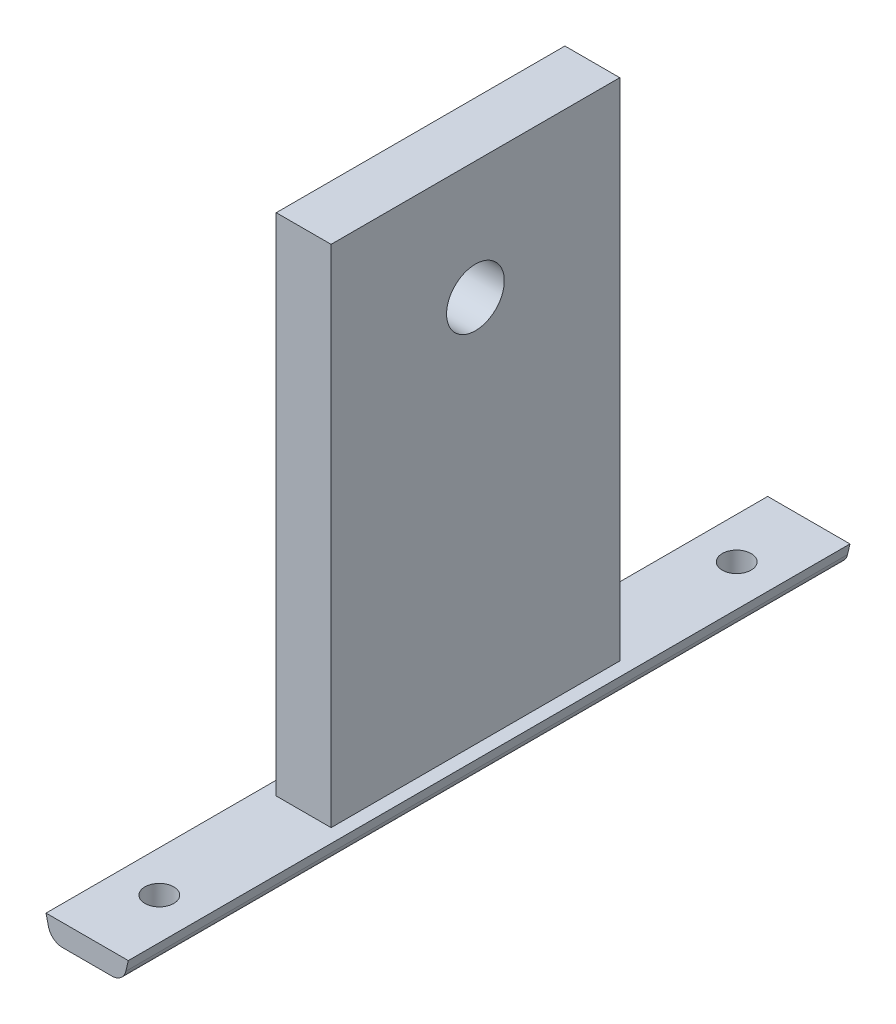
from build123d import *

# Parameters (mm, degrees)
RESSALTO_EXTRUS_O2_DEPTH   = 100
CORTE_EXTRUS_O4_DEPTH      = 30
CORTE_EXTRUS_O4_DEPTH_BACK = 1
ESBO_O2_W                  = 7.6
ESBO_O2_H                  = 70
CORTE_EXTRUS_O5_DEPTH      = 30
CORTE_EXTRUS_O7_DEPTH      = 21
CORTE_EXTRUS_O7_DEPTH_BACK = 22
F_3DSKETCH4_R              = 2
CORTE_EXTRUS_O8_START      = -3.8
CORTE_EXTRUS_O8_OUTLINE_R  = 4
CORTE_EXTRUS_O8_DEPTH      = 7.6


# Read off the part's stored shape, not the designer's step: Corte-extrusão8
with BuildPart() as part:
    # Esboço1 → Ressalto-extrusão2 (new body)
    with BuildSketch(Plane.XY):
        with BuildLine():
            Line((-3.8, -48.178624659), (-5.7, -48.178624659))
            Line((-5.7, -48.178624659), (-5.360626179, -49.63308389))
            ThreePointArc((-5.360626179, -49.63308389), (-4.656141559, -50.745296045), (-3.41294376, -51.178624659))
            Line((-3.41294376, -51.178624659), (3.41294376, -51.178624659))
            ThreePointArc((3.41294376, -51.178624659), (4.656141559, -50.745296045), (5.360626179, -49.63308389))
            Line((5.360626179, -49.63308389), (5.7, -48.178624659))
            Line((5.7, -48.178624659), (3.8, -48.178624659))
            Line((3.8, -48.178624659), (3.8, 21.821375341))
            Line((3.8, 21.821375341), (-3.8, 21.821375341))
            Line((-3.8, 21.821375341), (-3.8, -48.178624659))
        make_face()
    extrude(amount=RESSALTO_EXTRUS_O2_DEPTH)

    # Esboço2 → Corte-extrusão4 (cut, two sides: drawn at the far end of the back side and taken through both)
    with BuildSketch(Plane.XY.offset(-CORTE_EXTRUS_O4_DEPTH_BACK)):
        with Locations((0, -13.178624659)):
            Rectangle(ESBO_O2_W, ESBO_O2_H)
    extrude(amount=CORTE_EXTRUS_O4_DEPTH + CORTE_EXTRUS_O4_DEPTH_BACK, mode=Mode.SUBTRACT)

    # 3DSketch1 → Corte-extrusão5 (cut)
    with BuildSketch(Plane(origin=(-3.8, 21.821375341, 100), x_dir=(0.10793712415834626, -0.9941577225110841, 0), z_dir=(0, 0, 1))):
        Polygon((0, 0), (0.820322144, 7.555598691), (70.411362719, 0), (69.591040576, -7.555598691), align=None)
    extrude(amount=-CORTE_EXTRUS_O5_DEPTH, mode=Mode.SUBTRACT)

    # 3DSketch4 → Corte-extrusão7 (cut, two sides: drawn at the far end of the back side and taken through both)
    with BuildSketch(Plane(origin=(0, -48.178624659, 10), x_dir=(0, 0, 1), z_dir=(0, 1, 0)).offset(-CORTE_EXTRUS_O7_DEPTH_BACK)):
        with Locations(Location((0, 0, 0), (0, 0, 180))):
            Circle(F_3DSKETCH4_R)
        with Locations(Location((80, 0, 0), (0, 0, 180))):
            Circle(F_3DSKETCH4_R)
    extrude(amount=CORTE_EXTRUS_O7_DEPTH + CORTE_EXTRUS_O7_DEPTH_BACK, mode=Mode.SUBTRACT)

    # Corte-extrusão8 outline → Corte-extrusão8 (cut)
    with BuildSketch(Plane.YZ.offset(CORTE_EXTRUS_O8_START)):
        with Locations((5.45168837, 50)):
            Circle(CORTE_EXTRUS_O8_OUTLINE_R)
    extrude(amount=CORTE_EXTRUS_O8_DEPTH, mode=Mode.SUBTRACT)


solid = part.part
